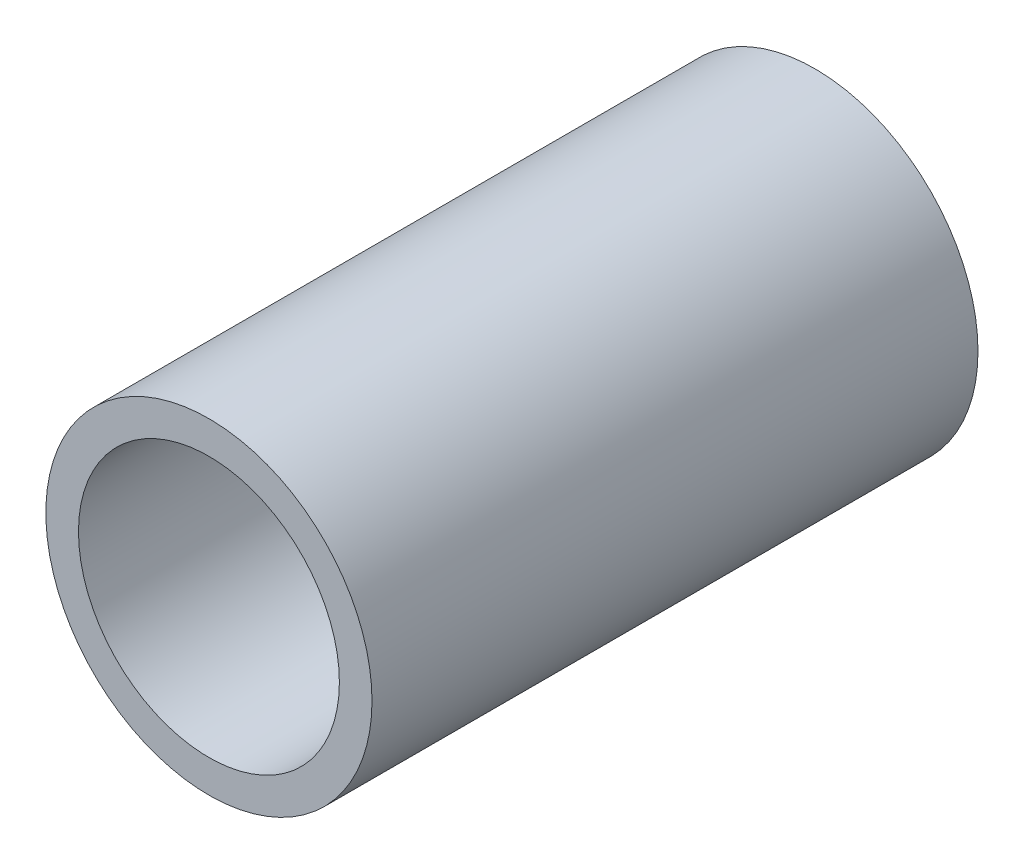
from build123d import *

# Parameters (mm, degrees)
SKETCH1_R           = 1.25
SKETCH1_R_2         = 1
BOSS_EXTRUDE1_DEPTH = 4.645


with BuildPart() as part:
    # Sketch1 → Boss-Extrude1 (new body)
    with BuildSketch(Plane.XY):
        Circle(SKETCH1_R)
        Circle(SKETCH1_R_2, mode=Mode.SUBTRACT)
    extrude(amount=BOSS_EXTRUDE1_DEPTH)


solid = part.part
